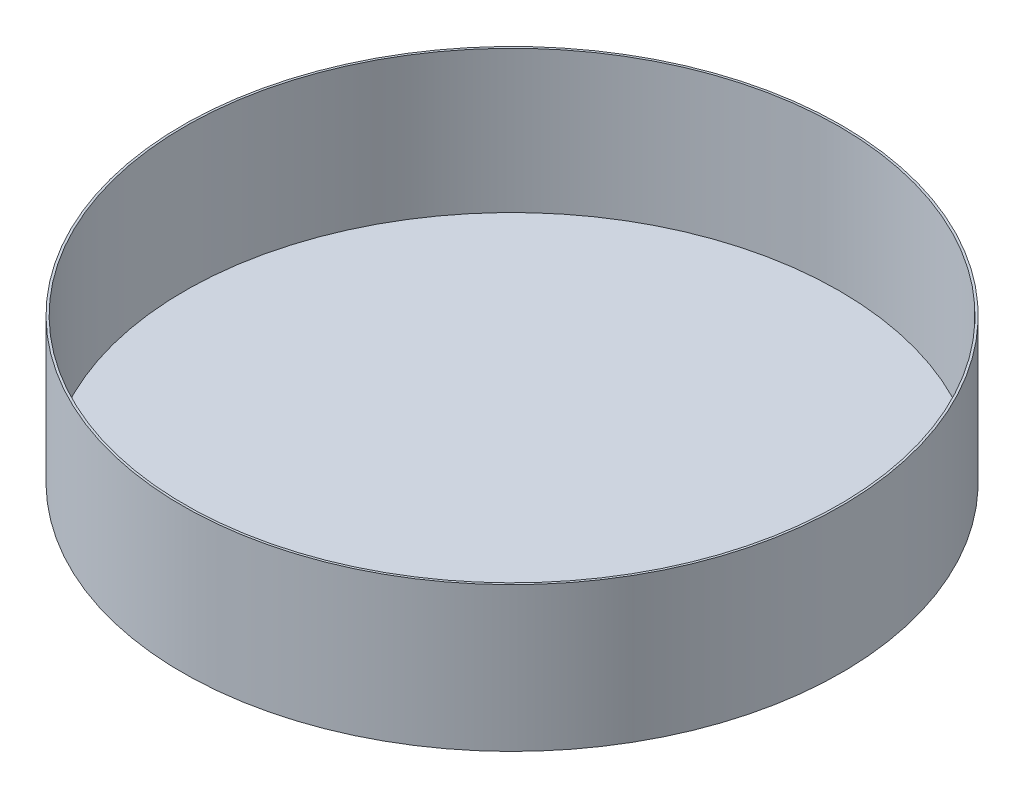
from build123d import *


with BuildPart() as part:
    # Sketch1 → Revolve1 (revolve)
    with BuildSketch(Plane.XY):
        Polygon((0, 0), (1495.54, 0), (1495.54, 650), (1505.54, 650), (1505.54, -10), (0, -10), align=None)
    revolve(axis=Axis((0, 0, 0), (0, 1, 0)))


solid = part.part
